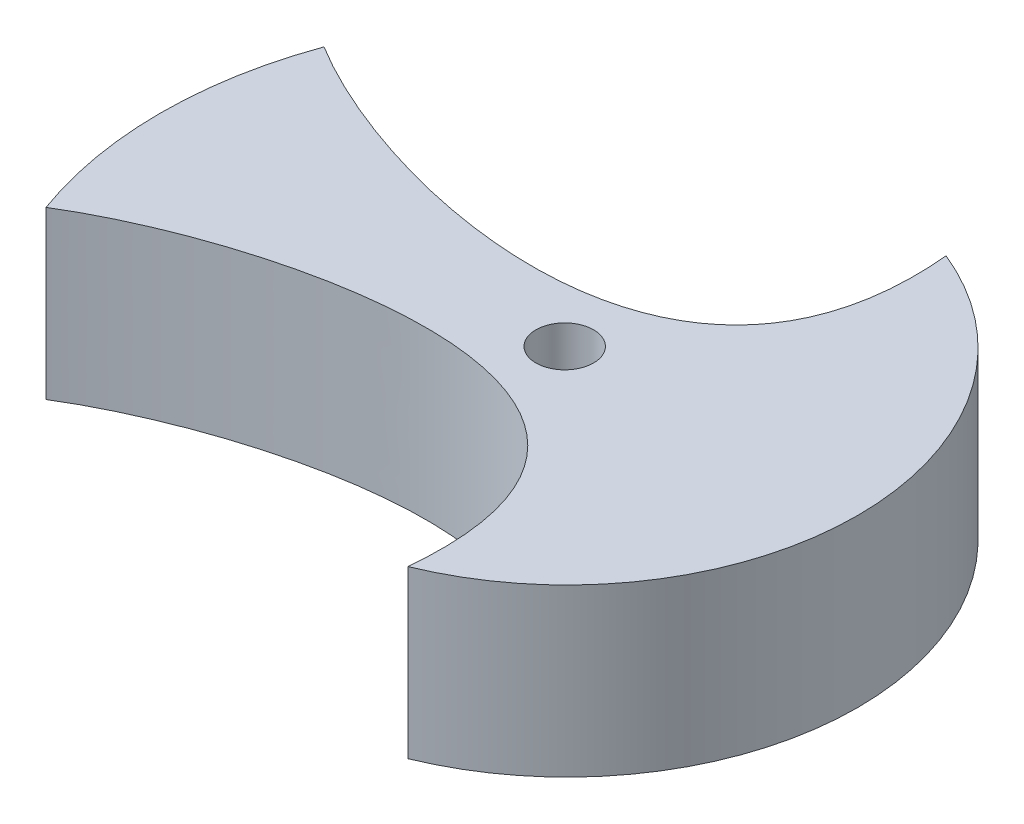
from build123d import *

# Parameters (mm, degrees)
BOSS_EXTRUDE1_DEPTH = 26
SKETCH3_R           = 4.5
CUT_EXTRUDE1_DEPTH  = 81.475281768


with BuildPart() as part:
    # Sketch2 → Boss-Extrude1 (new body)
    with BuildSketch(Plane(origin=(0, 0, 0), x_dir=(1, 0, 0), z_dir=(0, 1, 0))):
        with BuildLine():
            ThreePointArc((17.197407596, -42.047841196), (45.428754961, 0), (17.197407596, 42.047841196))
            add(Edge.make_bspline(
                [(-59.67048142, 21.718279101), (-35.828061003, 6.989353012), (21.716726931, -5.923069377), (17.197407596, 42.047841196)],
                knots=[0, 0, 0, 0, 1, 1, 1, 1], degree=3))
            ThreePointArc((-59.67048142, 21.718279101), (-63.5, 0), (-59.67048142, -21.718279101))
            add(Edge.make_bspline(
                [(-59.67048142, -21.718279101), (-35.828061003, -6.989353012), (21.716726931, 5.923069377), (17.197407596, -42.047841196)],
                knots=[0, 0, 0, 0, 1, 1, 1, 1], degree=3))
        make_face()
    extrude(amount=BOSS_EXTRUDE1_DEPTH)

    # Sketch3 → Cut-Extrude1 (cut, through all)
    with BuildSketch(Plane.XZ):
        with Locations((-0.338231588, 0.000115069)):
            Circle(SKETCH3_R)
    extrude(amount=-CUT_EXTRUDE1_DEPTH, mode=Mode.SUBTRACT)


solid = part.part
